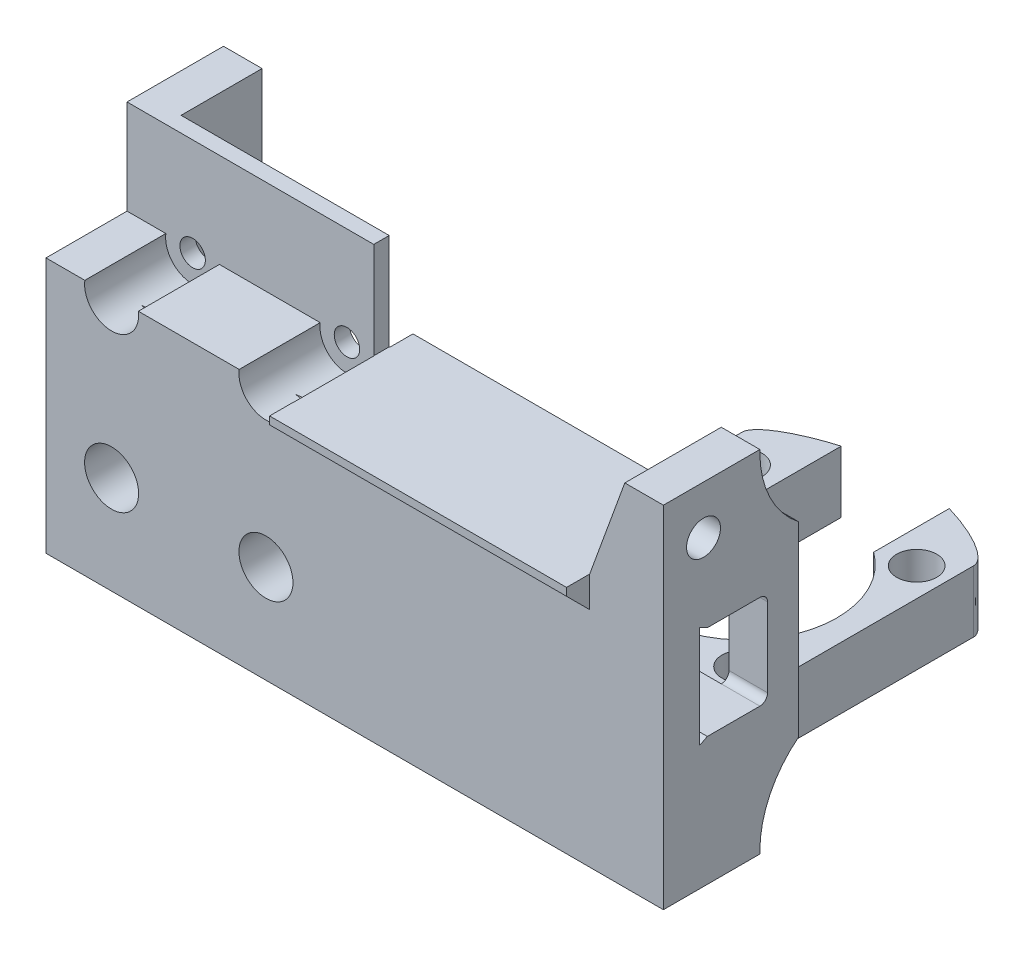
from build123d import *

# Parameters (mm, degrees)
SKETCH1_W               = 80
SKETCH1_H               = 45.4
SKETCH1_R               = 1.65
BOSS_EXTRUDE1_DEPTH     = 12.5
SKETCH2_W               = 5
SKETCH2_H               = 45.4
BOSS_EXTRUDE2_DEPTH     = 10.5
CUT_EXTRUDE1_DEPTH      = 7.8
CUT_EXTRUDE1_DEPTH_BACK = 93.830005925
SKETCH3_W               = 80
SKETCH3_H               = 12.2
SKETCH4_W               = 30
SKETCH4_H               = 8
BOSS_EXTRUDE3_DEPTH     = 44.2
SKETCH5_R               = 12
CUT_EXTRUDE2_DEPTH      = 45
CUT_EXTRUDE3_DEPTH      = 96.828388278
CUT_EXTRUDE3_DEPTH_BACK = 96.828388278
SKETCH6_R               = 2.6
FILLET1_SIZE            = 6
FILLET1_SIZE_2          = 15
SKETCH8_R               = 3.5
CUT_EXTRUDE5_DEPTH      = 10.5
SKETCH12_W              = 45
SKETCH12_H              = 12.25
CUT_EXTRUDE8_DEPTH      = 10.5
SKETCH13_W              = 14
SKETCH13_H              = 23.274164218
CUT_EXTRUDE10_DEPTH     = 10
SKETCH15_R              = 2.75
BOSS_EXTRUDE6_DEPTH     = 2
SKETCH16_W              = 43.029059925
SKETCH16_H              = 12.5
CUT_EXTRUDE11_DEPTH     = 12.5
CHAMFER2_SIZE2          = 12.5
CHAMFER2_SIZE           = 4.549627928
SKETCH17_R              = 2.2
CUT_EXTRUDE12_DEPTH     = 10
CUT_EXTRUDE13_DEPTH     = 102.559280367
SKETCH19_W              = 5
SKETCH19_H              = 24.2
BOSS_EXTRUDE7_DEPTH     = 5
SKETCH20_W              = 1
SKETCH20_H              = 12.2
CUT_EXTRUDE14_DEPTH     = 102.559280367
SKETCH21_W              = 5
SKETCH21_H              = 9.5
BOSS_EXTRUDE8_DEPTH     = 12.2
FILLET2_R               = 1
FILLET3_R               = 13
CHAMFER1_SIZE           = 2
SKETCH22_W              = 38.479431997
SKETCH22_H              = 1
BOSS_EXTRUDE9_DEPTH     = 3
SKETCH23_W              = 38.4
SKETCH23_H              = 1
BOSS_EXTRUDE10_DEPTH    = 3
CHAMFER3_SIZE           = 3


# Some blends are built 0.0001 mm under size
with BuildPart() as part:
    # Sketch1 → Boss-Extrude1 (new body)
    with BuildSketch(Plane.XY):
        with Locations((40, 22.7)):
            Rectangle(SKETCH1_W, SKETCH1_H)
        with Locations((8.499989197, 32.7)):
            Circle(SKETCH1_R, mode=Mode.SUBTRACT)
        with Locations((28.499989197, 32.7)):
            Circle(SKETCH1_R, mode=Mode.SUBTRACT)
        with Locations((28.499989197, 12.7)):
            Circle(SKETCH1_R, mode=Mode.SUBTRACT)
        with Locations((8.499989197, 12.7)):
            Circle(SKETCH1_R, mode=Mode.SUBTRACT)
    extrude(amount=BOSS_EXTRUDE1_DEPTH)

    # Sketch2 → Boss-Extrude2 (add)
    with BuildSketch(Plane(origin=(0, 0, 0), x_dir=(-1, 0, 0), z_dir=(0, 0, -1))):
        with Locations((-2.5, 22.7)):
            Rectangle(SKETCH2_W, SKETCH2_H)
    extrude(amount=BOSS_EXTRUDE2_DEPTH)

    # Sketch3 → Cut-Extrude1 (cut, two sides: drawn at the far end of the back side and taken through both)
    with BuildSketch(Plane.XY.offset(-CUT_EXTRUDE1_DEPTH_BACK)):
        with Locations((40, 22.7)):
            Rectangle(SKETCH3_W, SKETCH3_H)
    extrude(amount=CUT_EXTRUDE1_DEPTH + CUT_EXTRUDE1_DEPTH_BACK, mode=Mode.SUBTRACT)

    # Sketch4 → Boss-Extrude3 (add)
    with BuildSketch(Plane(origin=(0, 0, 0), x_dir=(-1, 0, 0), z_dir=(0, 0, -1))):
        with Locations((-54.5, 4)):
            Rectangle(SKETCH4_W, SKETCH4_H)
    extrude(amount=BOSS_EXTRUDE3_DEPTH)

    # Sketch5 → Cut-Extrude2 (cut)
    with BuildSketch(Plane(origin=(0, 8, 0), x_dir=(1, 0, 0), z_dir=(0, 1, 0))):
        with Locations(Location((54.495569327, 23.5, 0), (0, 0, 270))):
            Circle(SKETCH5_R)
    extrude(amount=-CUT_EXTRUDE2_DEPTH, mode=Mode.SUBTRACT)

    # Sketch6 → Cut-Extrude3 (cut, two sides: drawn at the far end of the back side and taken through both)
    with BuildSketch(Plane.XZ.offset(-16.6).offset(-CUT_EXTRUDE3_DEPTH_BACK)):
        with Locations((54.495569327, -39.201340104)):
            Circle(SKETCH6_R)
        with Locations((65.809277826, -34.515048603)):
            Circle(SKETCH6_R)
        with Locations((43.181860828, -34.515048603)):
            Circle(SKETCH6_R)
        with Locations((43.181860828, -11.887631605)):
            Circle(SKETCH6_R)
        with Locations((65.809277826, -11.887631605)):
            Circle(SKETCH6_R)
    extrude(amount=CUT_EXTRUDE3_DEPTH + CUT_EXTRUDE3_DEPTH_BACK, mode=Mode.SUBTRACT)

    # Fillet1
    # a fillet whose section is not a circle: 15, 6 mm, written as the material it takes off along each edge
    with BuildSketch(Plane(origin=(39.5, -37.5, -44.2), x_dir=(0, 0, 1), z_dir=(0, 1, 0)), Plane(origin=(69.5, 45.5, -44.2), x_dir=(0, 0, 1), z_dir=(0, -1, 0))) as fillet1_piece_1:
        with BuildLine():
            Bezier((FILLET1_SIZE, 0), (0, 0), (0, FILLET1_SIZE_2), weights=[1, 0.428571429, 1])
            Line((0, FILLET1_SIZE_2), (0, 0))
            Line((0, 0), (FILLET1_SIZE, 0))
        make_face()
    extrude(amount=83, mode=Mode.SUBTRACT)

    # Sketch8 → Cut-Extrude5 (cut)
    with BuildSketch(Plane.XY.offset(12.5)):
        with Locations((8.499989197, 32.7)):
            Circle(SKETCH8_R)
        with Locations((28.499989197, 32.7)):
            Circle(SKETCH8_R)
        with Locations((8.499989197, 12.7)):
            Circle(SKETCH8_R)
        with Locations((28.499989197, 12.7)):
            Circle(SKETCH8_R)
    extrude(amount=-CUT_EXTRUDE5_DEPTH, mode=Mode.SUBTRACT)

    # Sketch12 → Cut-Extrude8 (cut)
    with BuildSketch(Plane.XY.offset(12.5)):
        with Locations((22.5, 39.275)):
            Rectangle(SKETCH12_W, SKETCH12_H)
    extrude(amount=-CUT_EXTRUDE8_DEPTH, mode=Mode.SUBTRACT)

    # Sketch13 → Cut-Extrude10 (cut)
    with BuildSketch(Plane(origin=(0, 8, 0), x_dir=(1, 0, 0), z_dir=(0, 1, 0))):
        with Locations((54.495569327, 39.201340104)):
            Rectangle(SKETCH13_W, SKETCH13_H)
    extrude(amount=-CUT_EXTRUDE10_DEPTH, mode=Mode.SUBTRACT)

    # Sketch15 → Boss-Extrude6 (add)
    with BuildSketch(Plane(origin=(0, 8, 0), x_dir=(1, 0, 0), z_dir=(0, 1, 0))):
        with Locations(Location((54.495569327, 7.201340104, 0), (0, 0, 90))):
            Circle(SKETCH15_R)
    extrude(amount=BOSS_EXTRUDE6_DEPTH)

    # Sketch16 → Cut-Extrude11 (cut)
    with BuildSketch(Plane(origin=(0, 45.4, 0), x_dir=(1, 0, 0), z_dir=(0, 1, 0))):
        with Locations((53.485470038, -6.25)):
            Rectangle(SKETCH16_W, SKETCH16_H)
    extrude(amount=-CUT_EXTRUDE11_DEPTH, mode=Mode.SUBTRACT)

    # Chamfer2
    chamfer2_edges = [part.edges().sort_by_distance(p)[0] for p in [
        (75, 32.9, 6.25),
    ]]
    chamfer2_side = [part.faces().sort_by_distance(p)[0] for p in [
        (74.909007441, 32.9, 6.25),
    ]]
    chamfer(chamfer2_edges, length=CHAMFER2_SIZE - 0.0001, length2=CHAMFER2_SIZE2 - 0.0001, reference=chamfer2_side[0])  # a hair under: the kernel refuses the full size

    # Sketch17 → Cut-Extrude12 (cut)
    with BuildSketch(Plane(origin=(80, 0, 0), x_dir=(0, 0, -1), z_dir=(1, 0, 0))):
        with Locations((-7.3, 39.15)):
            Circle(SKETCH17_R)
    extrude(amount=-CUT_EXTRUDE12_DEPTH, mode=Mode.SUBTRACT)

    # Sketch18 → Cut-Extrude13 (cut, through all)
    with BuildSketch(Plane(origin=(80, 0, 0), x_dir=(0, 0, -1), z_dir=(1, 0, 0))):
        Polygon((-7.8, 28.8), (-6.8, 28.8), (-7.8, 29.3), align=None)
        Polygon((-7.8, 16.6), (-7.8, 16.1), (-6.8, 16.6), align=None)
    extrude(amount=-CUT_EXTRUDE13_DEPTH, mode=Mode.SUBTRACT)

    # Sketch19 → Boss-Extrude7 (add)
    with BuildSketch(Plane(origin=(0, 0, 0), x_dir=(-1, 0, 0), z_dir=(0, 0, -1))):
        with Locations((-77.5, 22.7)):
            Rectangle(SKETCH19_W, SKETCH19_H)
    extrude(amount=BOSS_EXTRUDE7_DEPTH)

    # Sketch20 → Cut-Extrude14 (cut, through all)
    with BuildSketch(Plane(origin=(80, 0, 0), x_dir=(0, 0, -1), z_dir=(1, 0, 0))):
        with Locations((0.5, 22.7)):
            Rectangle(SKETCH20_W, SKETCH20_H)
    extrude(amount=-CUT_EXTRUDE14_DEPTH, mode=Mode.SUBTRACT)

    # Sketch21 → Boss-Extrude8 (add)
    with BuildSketch(Plane(origin=(0, 16.6, 0), x_dir=(1, 0, 0), z_dir=(0, 1, 0))):
        with Locations((2.5, 5.75)):
            Rectangle(SKETCH21_W, SKETCH21_H)
    extrude(amount=BOSS_EXTRUDE8_DEPTH)

    # Fillet2
    fillet2_edges = [part.edges().sort_by_distance(p)[0] for p in [
        (77.5, 16.6, -1),
        (77.5, 28.8, -1),
        (2.5, 16.6, -1),
        (2.5, 28.8, -1),
    ]]
    fillet(fillet2_edges, radius=FILLET2_R)

    # Fillet3
    # the kernel refuses this fillet: 13 mm, written as the material it adds along each edge
    with BuildSketch(Plane(origin=(80, 10.6, 0), x_dir=(0, -1, 0), z_dir=(-1, 0, 0)), Plane(origin=(75, 34.8, 0), x_dir=(0, 1, 0), z_dir=(1, 0, 0))) as fillet3_piece_1:
        with BuildLine():
            CenterArc((10.246950766, -13), FILLET3_R, 90, 52.020127555)
            Line((0, -5), (0, 0))
            Line((0, 0), (10.246950766, 0))
        make_face()
    extrude(amount=5)

    # Chamfer1
    chamfer1_edges = [part.edges().sort_by_distance(p)[0] for p in [
        (54.495569327, 10, -4.451340104),
    ]]
    chamfer(chamfer1_edges, length=CHAMFER1_SIZE - 0.0001)  # a hair under: the kernel refuses the full size

    # Sketch22 → Boss-Extrude9 (add)
    with BuildSketch(Plane.XY.offset(12.5)):
        with Locations((51.210656074, 32.4)):
            Rectangle(SKETCH22_W, SKETCH22_H)
    extrude(amount=BOSS_EXTRUDE9_DEPTH)

    # Sketch23 → Boss-Extrude10 (add)
    with BuildSketch(Plane(origin=(0, 0, 0), x_dir=(-1, 0, 0), z_dir=(0, 0, -1))):
        with Locations((-51.250372072, 32.4)):
            Rectangle(SKETCH23_W, SKETCH23_H)
    extrude(amount=BOSS_EXTRUDE10_DEPTH)

    # Chamfer3
    chamfer3_edges = [part.edges().sort_by_distance(p)[0] for p in [
        (51.210656074, 31.9, 12.5),
        (51.250372072, 31.9, 0),
    ]]
    chamfer(chamfer3_edges, length=CHAMFER3_SIZE - 0.0001)  # a hair under: the kernel refuses the full size


solid = part.part
